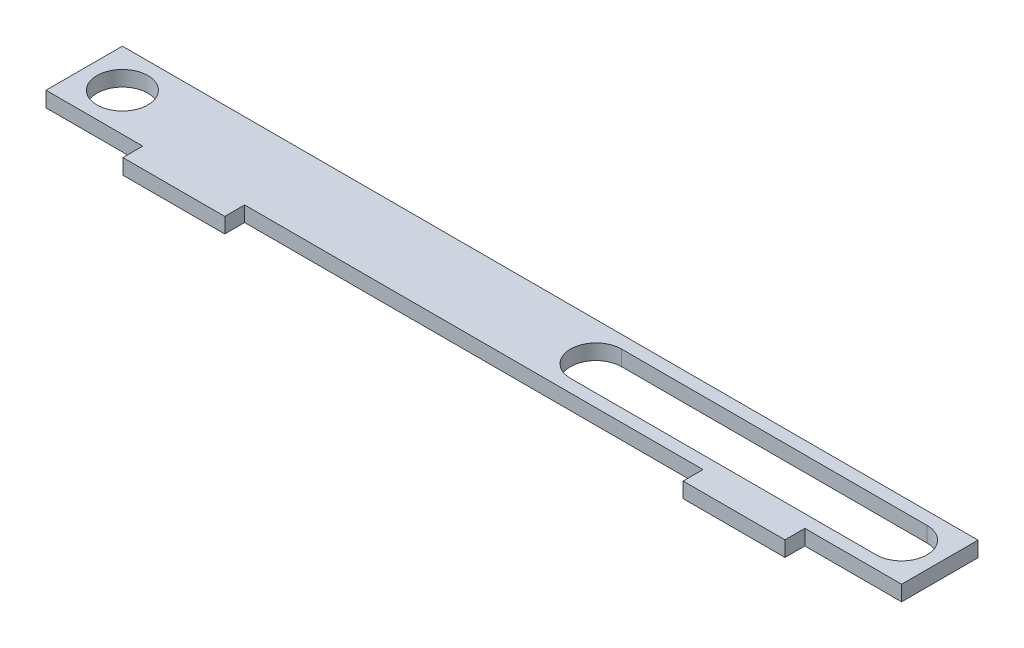
from build123d import *

# Parameters (mm, degrees)
SKETCH1_R           = 5
BOSS_EXTRUDE1_DEPTH = 3


with BuildPart() as part:
    # Sketch1 → Boss-Extrude1 (new body)
    with BuildSketch(Plane(origin=(0, 0, 0), x_dir=(1, 0, 0), z_dir=(0, 1, 0))):
        Polygon((0, 0), (19, 0), (19, -3.9), (39, -3.9), (39, 0), (129, 0), (129, -3.9), (149, -3.9), (149, 0), (168, 0), (168, 15), (0, 15), align=None)
        with Locations((7.5, 7.5)):
            Circle(SKETCH1_R, mode=Mode.SUBTRACT)
        with BuildLine():
            Line((160.5, 2.5), (100.5, 2.5))
            ThreePointArc((100.5, 2.5), (95.5, 7.5), (100.5, 12.5))
            Line((100.5, 12.5), (160.5, 12.5))
            ThreePointArc((160.5, 12.5), (165.5, 7.5), (160.5, 2.5))
        make_face(mode=Mode.SUBTRACT)
    extrude(amount=BOSS_EXTRUDE1_DEPTH)


solid = part.part
